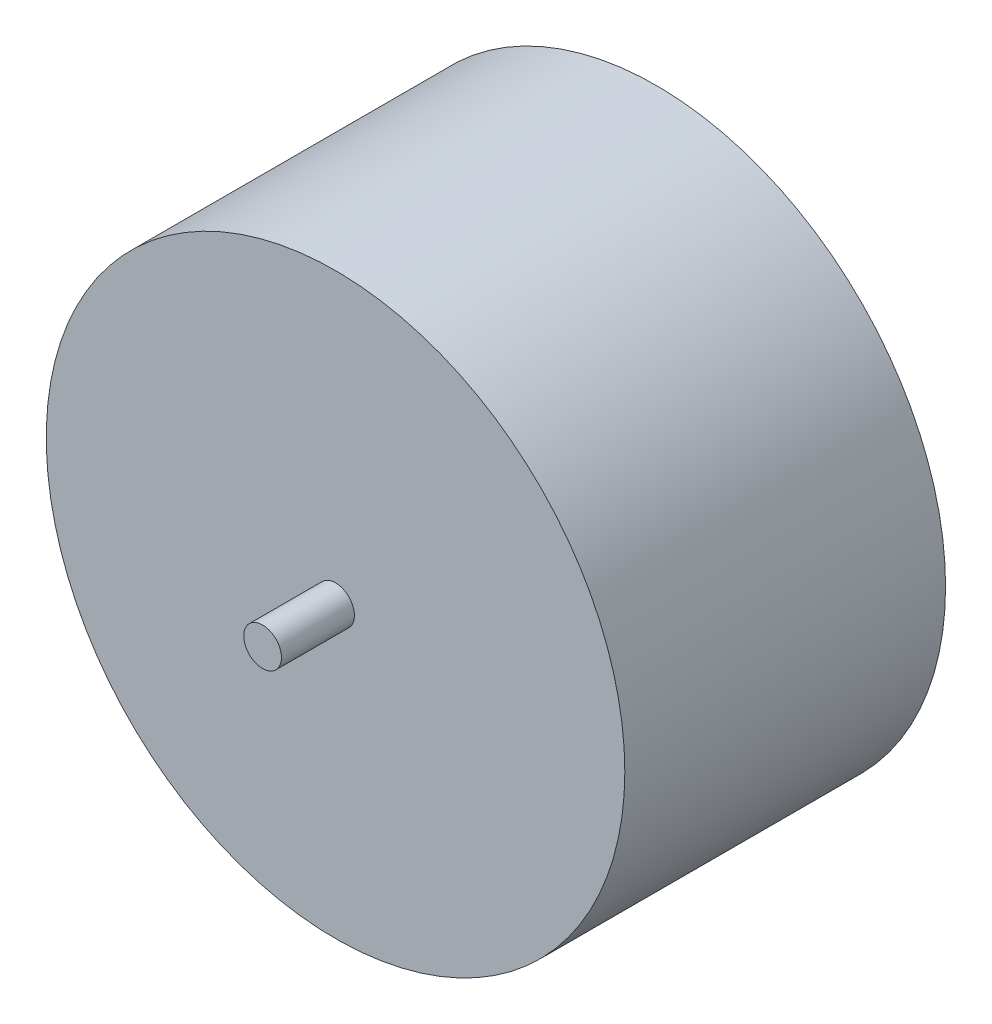
from build123d import *

# Parameters (mm, degrees)
SKETCH1_R           = 23
BOSS_EXTRUDE1_DEPTH = 25.5
SKETCH3_R           = 1.5
BOSS_EXTRUDE4_DEPTH = 5.8


with BuildPart() as part:
    # Sketch1 → Boss-Extrude1 (new body)
    with BuildSketch(Plane.XY):
        Circle(SKETCH1_R)
    extrude(amount=BOSS_EXTRUDE1_DEPTH)

    # Sketch3 → Boss-Extrude4 (add)
    with BuildSketch(Plane.XY.offset(25.5)):
        Circle(SKETCH3_R)
    extrude(amount=BOSS_EXTRUDE4_DEPTH)


solid = part.part
